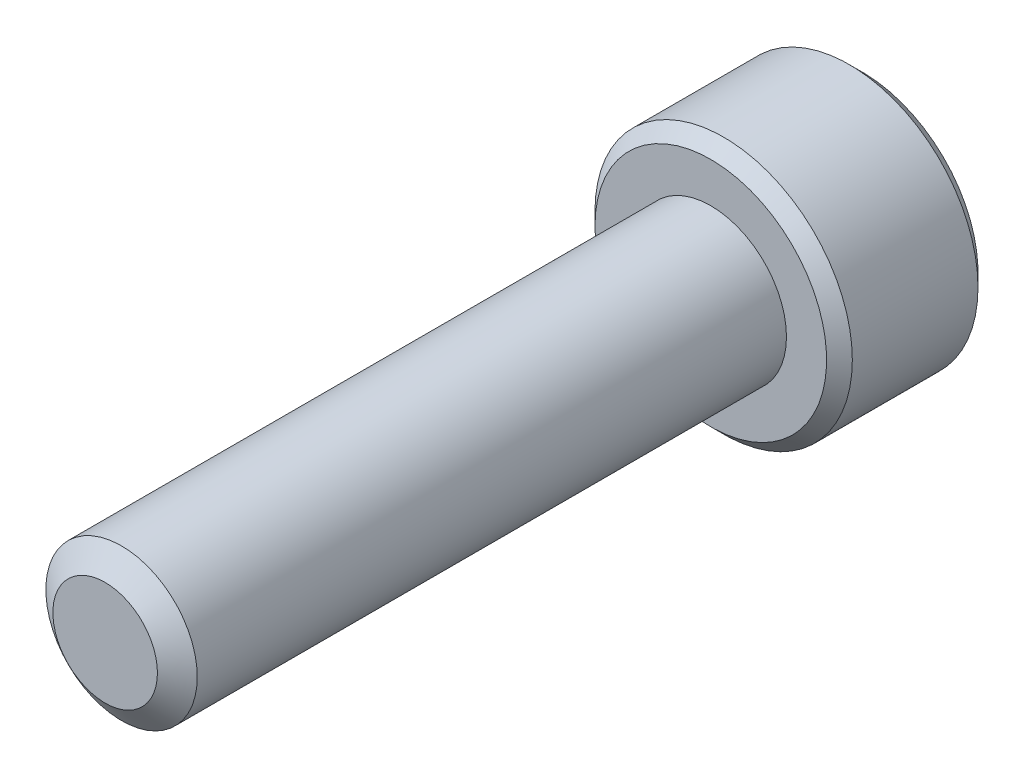
from build123d import *

# Parameters (mm, degrees)
SKETCH1_R          = 2.5
EXTRUDE1_DEPTH     = 20
SKETCH6_R          = 4.25
EXTRUDE2_DEPTH     = 5
CUT_EXTRUDE1_DEPTH = 3
CHAMFER1_SIZE      = 0.425


with BuildPart() as part:
    # Sketch1 → Extrude1 (new body)
    with BuildSketch(Plane.XY):
        Circle(SKETCH1_R)
    extrude(amount=-EXTRUDE1_DEPTH)

    # Sketch4 → Cut-Revolve1 (revolve, cut)
    with BuildSketch(Plane(origin=(0, 0, 0), x_dir=(0, 0, -1), z_dir=(1, 0, 0))):
        Polygon((0.541691224, 2.5), (0, 1.726384758), (0, 2.5), align=None)
    revolve(axis=Axis((0, 0, 0), (0, 0, -1)), mode=Mode.SUBTRACT)

    # Sketch6 → Extrude2 (add)
    with BuildSketch(Plane(origin=(0, 0, -20), x_dir=(-1, 0, 0), z_dir=(0, 0, -1))):
        Circle(SKETCH6_R)
    extrude(amount=EXTRUDE2_DEPTH)

    # Sketch7 → Cut-Extrude1 (cut)
    with BuildSketch(Plane(origin=(0, 0, -25), x_dir=(-1, 0, 0), z_dir=(0, 0, -1))):
        Polygon((0, 2.309401077), (-2, 1.154700538), (-2, -1.154700538), (0, -2.309401077), (2, -1.154700538), (2, 1.154700538), align=None)
    extrude(amount=-CUT_EXTRUDE1_DEPTH, mode=Mode.SUBTRACT)

    # Cut-Extrude2 cone 1 section (through the dimple's axis) → Cut-Extrude2 (revolve, cut)
    with BuildSketch(Plane(origin=(0, 0, -25), x_dir=(0, 1, 0), z_dir=(1, 0, 0))):
        Polygon((0, 0), (2.309401077, 0), (0, 2.309401077), align=None)
    revolve(axis=Axis((0, 0, -25), (0, 0, 1)), mode=Mode.SUBTRACT)

    # Chamfer1
    chamfer1_edges = [part.edges().sort_by_distance(p)[0] for p in [
        (4.25, 0, -25),
        (4.25, 0, -20),
    ]]
    chamfer(chamfer1_edges, length=CHAMFER1_SIZE)


solid = part.part
